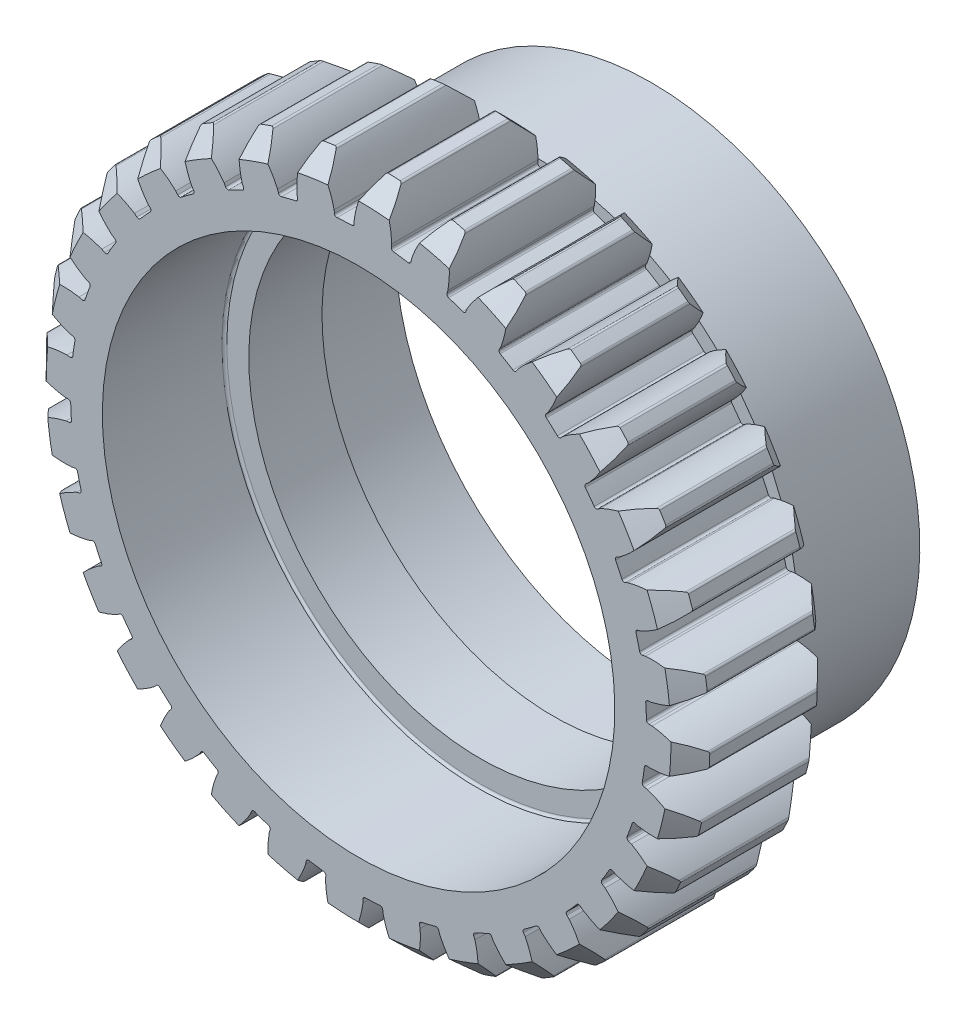
from build123d import *

# Parameters (mm, degrees)
FILLET_1_R                       = 0.3
FILLET_2_R                       = 0.1
EXTRUDE_1_DEPTH                  = 3
FILLET_3_R                       = 0.1
PATTERN_CIRCULAR_1_COUNT         = 32
FILLET_3_OF_PATTERN_CIRCULAR_1_R = 0.1


with BuildPart() as part:
    # Эскиз18 → Повернуть1 (revolve)
    with BuildSketch(Plane(origin=(0, 0, 0), x_dir=(0, 0, -1), z_dir=(1, 0, 0))):
        Polygon((-6.5, -10.5), (-1.5, -10.5), (-1.5, -9.5), (1.5, -9.5), (1.5, -10.5), (5.5, -10.5), (5.5, -11), (0.5, -11), (0.5, -10), (-0.5, -10), (-0.5, -11.8), (-6.5, -11.8), align=None)
    revolve(axis=Axis((0, 0, 0), (0, 0, 1)))

    # Скругление1
    fillet_1_edges = [part.edges().sort_by_distance(p)[0] for p in [
        (0, 10, -0.5),
        (0, 10, 0.5),
    ]]
    fillet(fillet_1_edges, radius=FILLET_1_R)

    # Скругление2
    fillet_2_edges = [part.edges().sort_by_distance(p)[0] for p in [
        (0, 10.5, 1.5),
        (0, 10.5, -1.5),
    ]]
    fillet(fillet_2_edges, radius=FILLET_2_R)

    # Эскиз19 → Бобышка-Вытянуть1 (add, symmetric)
    with BuildSketch(Plane.XY.offset(3.5)):
        with BuildLine():
            Line((-0.179264269, 12.02672961), (-0.175865218, 11.798689394))
            ThreePointArc((-0.175865218, 11.798689394), (0.578998557, 11.785786383), (1.331492173, 11.724637674))
            Line((1.331492173, 11.724637674), (1.357226706, 11.951246648))
            add(Edge.make_bspline(
                [(1.357226706, 11.951246648), (1.329458515, 12.798710581), (0.964008421, 13.565791085)],
                knots=[0, 0, 0, 1, 1, 1], degree=2))
            ThreePointArc((0.964008421, 13.565791085), (0.667320371, 13.583618204), (0.370313592, 13.594957442))
            add(Edge.make_bspline(
                [(-0.179264269, 12.02672961), (-0.068563798, 12.867391013), (0.370313592, 13.594957442)],
                knots=[0, 0, 0, 1, 1, 1], degree=2))
        make_face()
    extrude_1 = extrude(amount=EXTRUDE_1_DEPTH, both=True)

    # Скругление3
    fillet_3_edges = [part.edges().sort_by_distance(p)[0] for p in [
        (-0.175865218, 11.798689394, 3.5),
        (1.331492173, 11.724637674, 3.5),
        (0.964008421, 13.565791085, 5),
        (0.370313592, 13.594957442, 5),
    ]]
    fillet(fillet_3_edges, radius=FILLET_3_R)

    # Круговой массив1: Бобышка-Вытянуть1 ×32 about axis
    pattern_circular_1_axis = Axis((0, 0, 0), (0, 0, -1))
    for i in range(1, PATTERN_CIRCULAR_1_COUNT):
        add(extrude_1.rotate(pattern_circular_1_axis, i * 360 / PATTERN_CIRCULAR_1_COUNT))

    # Скругление3 of Круговой массив1
    fillet_3_of_pattern_circular_1_edges = [part.edges().sort_by_distance(p)[0] for p in [
        (2.129324096, 11.606290488, 3.5),
        (3.593271264, 11.239590812, 3.5),
        (3.59203982, 13.1170595, 5),
        (3.015442745, 13.261489549, 5),
        (4.352684679, 10.967868347, 3.5),
        (5.716962955, 10.322612778, 3.5),
        (6.082031144, 12.164246675, 5),
        (5.544690125, 12.418390049, 5),
        (6.408774031, 9.907957177, 3.5),
        (7.620954966, 9.008942524, 3.5),
        (8.338293422, 10.743968671, 5),
        (7.860858172, 11.098058785, 5),
        (8.218577791, 8.467288768, 3.5),
        (9.232077951, 7.349063662, 3.5),
        (10.27411976, 8.910805977, 5),
        (9.874937849, 9.351235345, 5),
        (9.712546216, 6.701227201, 3.5),
        (10.488417358, 5.406764404, 3.5),
        (11.815117437, 6.735206006, 5),
        (11.509529202, 7.245049175, 5),
        (10.833266937, 4.677641231, 3.5),
        (11.341692768, 3.256686222, 3.5),
        (12.902066777, 4.300775846, 5),
        (12.701815802, 4.860439829, 5),
        (11.537671284, 2.474296131, 3.5),
        (11.759113286, 0.981455415, 3.5),
        (13.493196927, 1.701069282, 5),
        (13.405978744, 2.289046505, 5),
        (11.798689394, 0.175865218, 3.5),
        (11.724637674, -1.331492173, 3.5),
        (13.565791085, -0.964008421, 5),
        (13.594957442, -0.370313592, 5),
        (11.606290488, -2.129324096, 3.5),
        (11.239590812, -3.593271264, 3.5),
        (13.1170595, -3.59203982, 5),
        (13.261489549, -3.015442745, 5),
        (10.967868347, -4.352684679, 3.5),
        (10.322612778, -5.716962955, 3.5),
        (12.164246675, -6.082031144, 5),
        (12.418390049, -5.544690125, 5),
        (9.907957177, -6.408774031, 3.5),
        (9.008942524, -7.620954966, 3.5),
        (10.743968671, -8.338293422, 5),
        (11.098058785, -7.860858172, 5),
        (8.467288768, -8.218577791, 3.5),
        (7.349063662, -9.232077951, 3.5),
        (8.910805977, -10.27411976, 5),
        (9.351235345, -9.874937849, 5),
        (6.701227201, -9.712546216, 3.5),
        (5.406764404, -10.488417358, 3.5),
        (6.735206006, -11.815117437, 5),
        (7.245049175, -11.509529202, 5),
        (4.677641231, -10.833266937, 3.5),
        (3.256686222, -11.341692768, 3.5),
        (4.300775846, -12.902066777, 5),
        (4.860439829, -12.701815802, 5),
        (2.474296131, -11.537671284, 3.5),
        (0.981455415, -11.759113286, 3.5),
        (1.701069282, -13.493196927, 5),
        (2.289046505, -13.405978744, 5),
        (0.175865218, -11.798689394, 3.5),
        (-1.331492173, -11.724637674, 3.5),
        (-0.964008421, -13.565791085, 5),
        (-0.370313592, -13.594957442, 5),
        (-2.129324096, -11.606290488, 3.5),
        (-3.593271264, -11.239590812, 3.5),
        (-3.59203982, -13.1170595, 5),
        (-3.015442745, -13.261489549, 5),
        (-4.352684679, -10.967868347, 3.5),
        (-5.716962955, -10.322612778, 3.5),
        (-6.082031144, -12.164246675, 5),
        (-5.544690125, -12.418390049, 5),
        (-6.408774031, -9.907957177, 3.5),
        (-7.620954966, -9.008942524, 3.5),
        (-8.338293422, -10.743968671, 5),
        (-7.860858172, -11.098058785, 5),
        (-8.218577791, -8.467288768, 3.5),
        (-9.232077951, -7.349063662, 3.5),
        (-10.27411976, -8.910805977, 5),
        (-9.874937849, -9.351235345, 5),
        (-9.712546216, -6.701227201, 3.5),
        (-10.488417358, -5.406764404, 3.5),
        (-11.815117437, -6.735206006, 5),
        (-11.509529202, -7.245049175, 5),
        (-10.833266937, -4.677641231, 3.5),
        (-11.341692768, -3.256686222, 3.5),
        (-12.902066777, -4.300775846, 5),
        (-12.701815802, -4.860439829, 5),
        (-11.537671284, -2.474296131, 3.5),
        (-11.759113286, -0.981455415, 3.5),
        (-13.493196927, -1.701069282, 5),
        (-13.405978744, -2.289046505, 5),
        (-11.798689394, -0.175865218, 3.5),
        (-11.724637674, 1.331492173, 3.5),
        (-13.565791085, 0.964008421, 5),
        (-13.594957442, 0.370313592, 5),
        (-11.606290488, 2.129324096, 3.5),
        (-11.239590812, 3.593271264, 3.5),
        (-13.1170595, 3.59203982, 5),
        (-13.261489549, 3.015442745, 5),
        (-10.967868347, 4.352684679, 3.5),
        (-10.322612778, 5.716962955, 3.5),
        (-12.164246675, 6.082031144, 5),
        (-12.418390049, 5.544690125, 5),
        (-9.907957177, 6.408774031, 3.5),
        (-9.008942524, 7.620954966, 3.5),
        (-10.743968671, 8.338293422, 5),
        (-11.098058785, 7.860858172, 5),
        (-8.467288768, 8.218577791, 3.5),
        (-7.349063662, 9.232077951, 3.5),
        (-8.910805977, 10.27411976, 5),
        (-9.351235345, 9.874937849, 5),
        (-6.701227201, 9.712546216, 3.5),
        (-5.406764404, 10.488417358, 3.5),
        (-6.735206006, 11.815117437, 5),
        (-7.245049175, 11.509529202, 5),
        (-4.677641231, 10.833266937, 3.5),
        (-3.256686222, 11.341692768, 3.5),
        (-4.300775846, 12.902066777, 5),
        (-4.860439829, 12.701815802, 5),
        (-2.474296131, 11.537671284, 3.5),
        (-0.981455415, 11.759113286, 3.5),
        (-1.701069282, 13.493196927, 5),
        (-2.289046505, 13.405978744, 5),
    ]]
    fillet(fillet_3_of_pattern_circular_1_edges, radius=FILLET_3_OF_PATTERN_CIRCULAR_1_R)

    # Эскиз21 → Вырез-Повернуть1 (revolve, cut)
    with BuildSketch(Plane(origin=(0, 0, 0), x_dir=(0, 0, -1), z_dir=(1, 0, 0))):
        Polygon((-6.5, 12.8), (-6.5, 13.6), (-5.7, 13.6), align=None)
        Polygon((-0.5, 13.6), (-1.3, 13.6), (-0.5, 12.8), align=None)
    revolve(axis=Axis((0, 0, 0), (0, 0, -1)), mode=Mode.SUBTRACT)


solid = part.part
